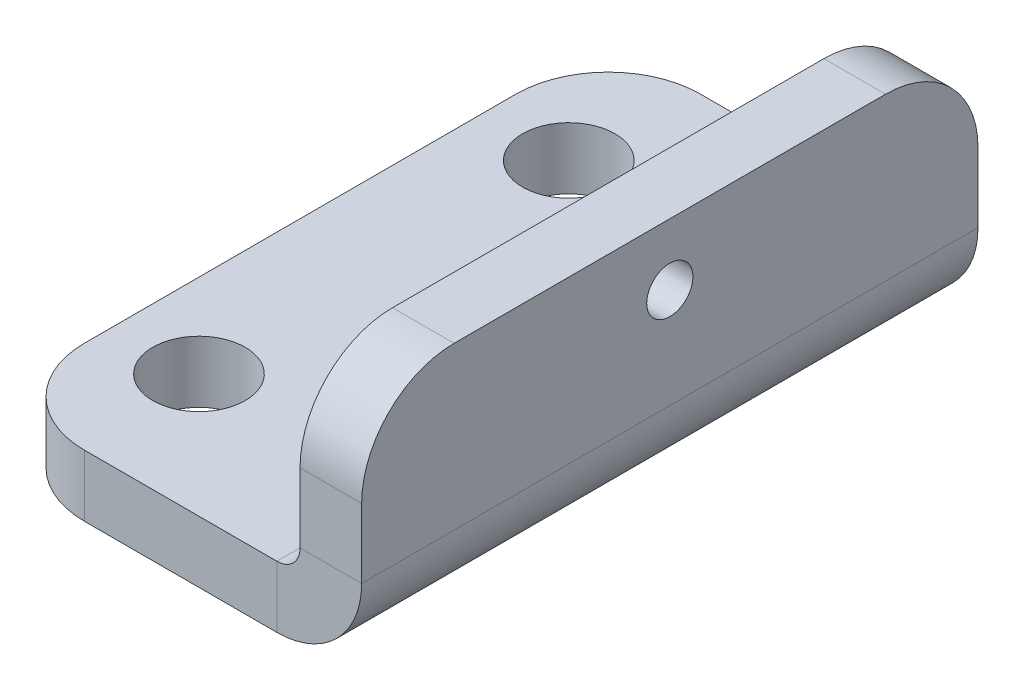
from build123d import *

# Parameters (mm, degrees)
BASE_FLANGE1_DEPTH = 10
FILLET1_R          = 3
SKETCH6_R          = 1.5
CUT_EXTRUDE1_DEPTH = 17.733200531
SKETCH7_R          = 0.75
CUT_EXTRUDE2_DEPTH = 17.248076809


# Sheet-metal steps are written as plain solids
with BuildPart() as part:
    # Sketch1 → Base-Flange1 (new, symmetric)
    with BuildSketch(Plane.XY):
        with BuildLine():
            Line((0, 8), (0, 2.75))
            ThreePointArc((0, 2.75), (-0.805456352, 0.805456352), (-2.75, 0))
            Line((-2.75, 0), (-12, 0))
            Line((-12, 0), (-12, 2))
            Line((-12, 2), (-2.75, 2))
            ThreePointArc((-2.75, 2), (-2.219669914, 2.219669914), (-2, 2.75))
            Line((-2, 2.75), (-2, 8))
            Line((-2, 8), (0, 8))
        make_face()
    extrude(amount=BASE_FLANGE1_DEPTH, both=True)

    # Fillet1
    fillet1_edges = [part.edges().sort_by_distance(p)[0] for p in [
        (-1, 8, 10),
        (-12, 1, 10),
        (-1, 8, -10),
        (-12, 1, -10),
    ]]
    fillet(fillet1_edges, radius=FILLET1_R)

    # Sketch6 → Cut-Extrude1 (cut, through all)
    with BuildSketch(Plane(origin=(0, 2, 0), x_dir=(1, 0, 0), z_dir=(0, 1, 0))):
        with Locations(Location((-9.278968908, 6, 0), (0, 0, 180))):
            Circle(SKETCH6_R)
        with Locations((-9.278968908, -6)):
            Circle(SKETCH6_R)
    extrude(amount=-CUT_EXTRUDE1_DEPTH, mode=Mode.SUBTRACT)

    # Sketch7 → Cut-Extrude2 (cut, through all)
    with BuildSketch(Plane.ZY.offset(2)):
        with Locations((0, 6)):
            Circle(SKETCH7_R)
    extrude(amount=-CUT_EXTRUDE2_DEPTH, mode=Mode.SUBTRACT)


solid = part.part
